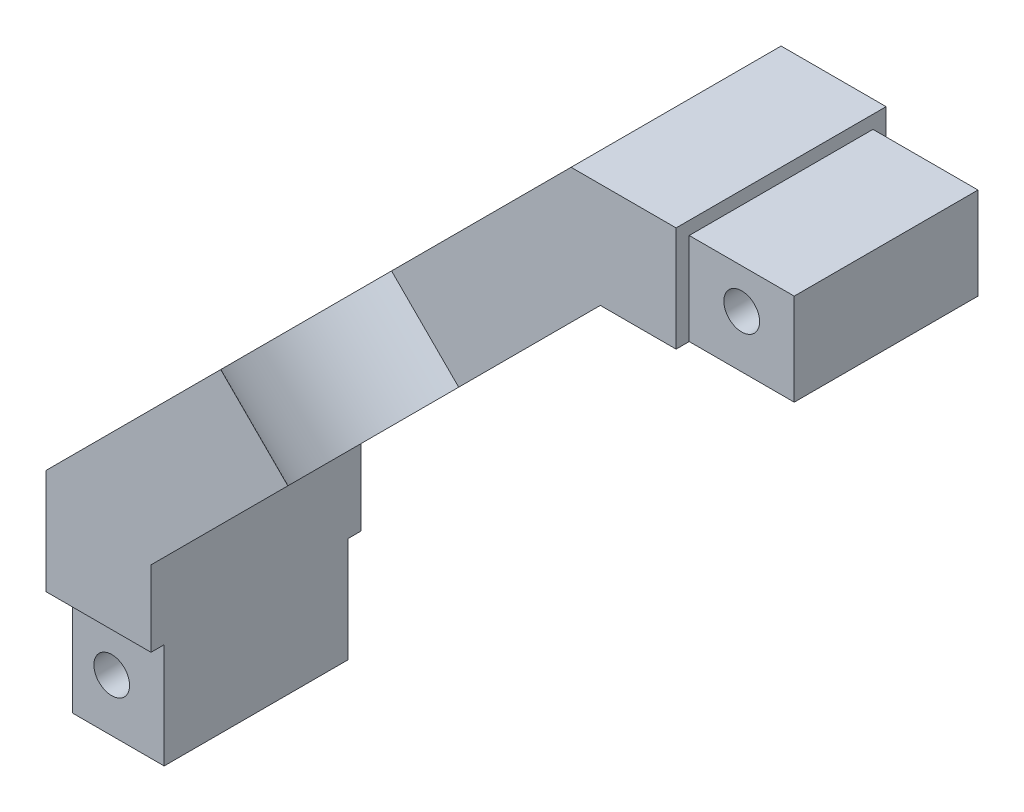
from build123d import *

# Parameters (mm, degrees)
BOSS_EXTRUDE1_DEPTH    = 25.4
SKETCH2_R              = 2.159
SKETCH2_W              = 12.7
SKETCH2_H              = 1.5875
SKETCH2_W_2            = 1.5875
SKETCH2_H_2            = 12.7
CUT_EXTRUDE1_DEPTH     = 25.4
SKETCH3_W              = 12.7
SKETCH3_H              = 1.5875
SKETCH3_H_2            = 1.5748
CUT_EXTRUDE2_DEPTH     = 12.7
SKETCH4_W              = 1.5875
SKETCH4_H              = 12.7
CUT_EXTRUDE3_DEPTH     = 12.7
F_3DSKETCH1_R          = 19.05
F_3DSKETCH1_R_2        = 11.1125
BOSS_EXTRUDE2_DEPTH    = 11.482870812
CUT_EXTRUDE4_START     = 44.901280605
CUT_EXTRUDE4_OUTLINE_R = 11.1125
CUT_EXTRUDE4_DEPTH     = 11.482870812


# Read off the part's stored shape, not the designer's step: Cut-Extrude4
with BuildPart() as part:
    # Sketch1 → Boss-Extrude1 (new body)
    with BuildSketch(Plane.XY):
        Polygon((88.9, 0), (63.5, 0), (0, -63.5), (0, -88.9), (12.7, -88.9), (12.7, -67.039231637), (67.039231637, -12.7), (88.9, -12.7), align=None)
    extrude(amount=BOSS_EXTRUDE1_DEPTH)

    # Sketch2 → Cut-Extrude1 (cut)
    with BuildSketch(Plane.XY.offset(25.4)):
        with Locations((82.55, -6.3627)):
            Circle(SKETCH2_R)
        with Locations((6.3627, -82.55)):
            Circle(SKETCH2_R)
        with Locations((82.55, -0.79375)):
            Rectangle(SKETCH2_W, SKETCH2_H)
        with Locations((0.79375, -82.55)):
            Rectangle(SKETCH2_W_2, SKETCH2_H_2)
    extrude(amount=-CUT_EXTRUDE1_DEPTH, mode=Mode.SUBTRACT)

    # Sketch3 → Cut-Extrude2 (cut)
    with BuildSketch(Plane.XZ.offset(88.9)):
        with Locations((6.35, 24.60625)):
            Rectangle(SKETCH3_W, SKETCH3_H)
        with Locations((6.35, 0.7874)):
            Rectangle(SKETCH3_W, SKETCH3_H_2)
    extrude(amount=-CUT_EXTRUDE2_DEPTH, mode=Mode.SUBTRACT)

    # Sketch4 → Cut-Extrude3 (cut)
    with BuildSketch(Plane(origin=(88.9, 0, 0), x_dir=(0, 0, -1), z_dir=(1, 0, 0))):
        with Locations((-0.79375, -6.35)):
            Rectangle(SKETCH4_W, SKETCH4_H)
        with Locations((-24.60625, -6.35)):
            Rectangle(SKETCH4_W, SKETCH4_H)
    extrude(amount=-CUT_EXTRUDE3_DEPTH, mode=Mode.SUBTRACT)

    # 3DSketch1 → Boss-Extrude2 (add)
    with BuildSketch(Plane(origin=(67.039231637, -12.7, 0), x_dir=(-0.6713837490692134, -0.6713837490692195, 0.3138275369873187), z_dir=(0.7071067811865508, -0.7071067811865444, 0))):
        with Locations((40.468086778, 0)):
            Circle(F_3DSKETCH1_R)
        with Locations((40.468086778, 0)):
            Circle(F_3DSKETCH1_R_2, mode=Mode.SUBTRACT)
    extrude(amount=-BOSS_EXTRUDE2_DEPTH)

    # Cut-Extrude4 outline → Cut-Extrude4 (cut)
    with BuildSketch(Plane(origin=(0, 0, 0), x_dir=(0.7071067811865438, 0.7071067811865512, 0), z_dir=(0.7071067811865511, -0.7071067811865441, 0)).offset(CUT_EXTRUDE4_START)):
        with Locations((0, 12.7)):
            Circle(CUT_EXTRUDE4_OUTLINE_R)
    extrude(amount=CUT_EXTRUDE4_DEPTH, mode=Mode.SUBTRACT)


solid = part.part
